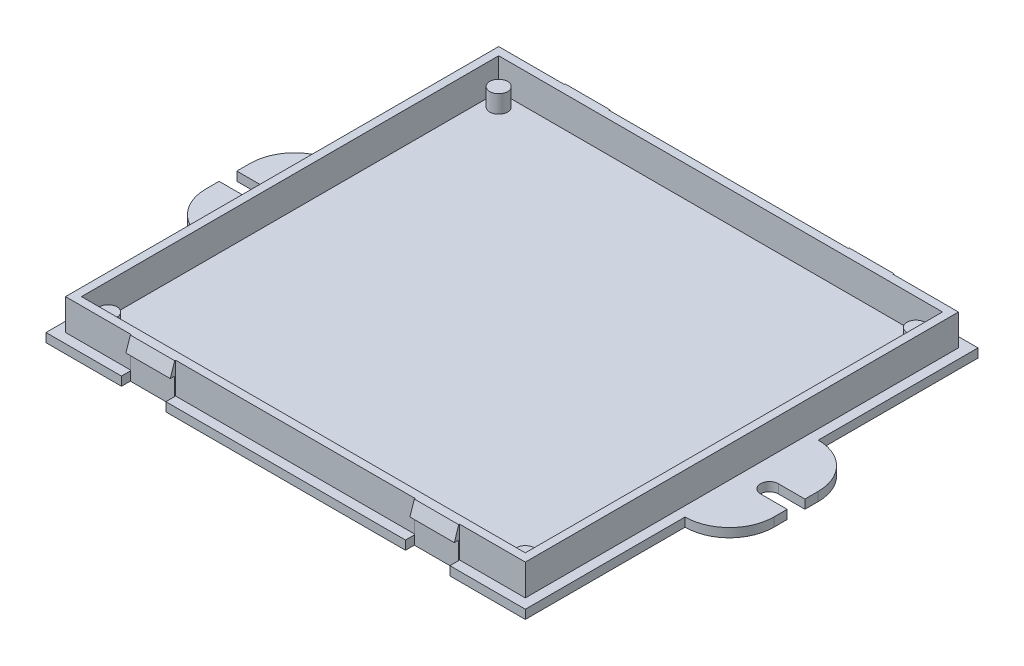
from build123d import *

# Parameters (mm, degrees)
SKETCH1_W            = 108
SKETCH1_H            = 102
BOSS_EXTRUDE1_DEPTH  = 2
SKETCH2_W            = 104
SKETCH2_H            = 98
BOSS_EXTRUDE2_DEPTH  = 7
SKETCH3_W            = 100
SKETCH3_H            = 94
CUT_EXTRUDE1_DEPTH   = 7
SKETCH4_W            = 10
SKETCH4_H            = 3
BOSS_EXTRUDE6_DEPTH  = 1
CUT_EXTRUDE2_DEPTH   = 10
SKETCH6_W            = 10
SKETCH6_H            = 3
BOSS_EXTRUDE7_DEPTH  = 1
CUT_EXTRUDE3_DEPTH   = 10
SKETCH9_W            = 10
SKETCH9_H            = 3
BOSS_EXTRUDE9_DEPTH  = 1
CUT_EXTRUDE4_DEPTH   = 10
SKETCH11_W           = 10
SKETCH11_H           = 3
BOSS_EXTRUDE10_DEPTH = 1
CUT_EXTRUDE5_DEPTH   = 10
SKETCH20_W           = 10
SKETCH20_H           = 2
CUT_EXTRUDE7_DEPTH   = 2
SKETCH21_W           = 10
SKETCH21_H           = 2
CUT_EXTRUDE8_DEPTH   = 2
SKETCH22_W           = 10
SKETCH22_H           = 2
CUT_EXTRUDE9_DEPTH   = 2
SKETCH23_W           = 10
SKETCH23_H           = 2
CUT_EXTRUDE11_DEPTH  = 2
SKETCH24_R           = 2
BOSS_EXTRUDE11_DEPTH = 4
BOSS_EXTRUDE12_DEPTH = 4
BOSS_EXTRUDE13_DEPTH = 4
BOSS_EXTRUDE14_DEPTH = 4
SKETCH28_W           = 30
SKETCH28_H           = 2
BOSS_EXTRUDE15_DEPTH = 10
SKETCH29_R           = 2
SKETCH29_W           = 6
SKETCH29_H           = 4
CUT_EXTRUDE12_DEPTH  = 2
FILLET1_R            = 10
SKETCH30_W           = 30
SKETCH30_H           = 1
BOSS_EXTRUDE16_DEPTH = 10
CUT_EXTRUDE13_DEPTH  = 2
FILLET2_R            = 10
SKETCH33_W           = 0.2
SKETCH33_H           = 98
CUT_EXTRUDE14_DEPTH  = 7
SKETCH34_W           = 14.8
SKETCH34_H           = 0.2
CUT_EXTRUDE15_DEPTH  = 7
SKETCH35_W           = 54
SKETCH35_H           = 0.2
CUT_EXTRUDE16_DEPTH  = 7
SKETCH36_W           = 15
SKETCH36_H           = 0.2
CUT_EXTRUDE17_DEPTH  = 7
SKETCH37_W           = 0.2
SKETCH37_H           = 97.8
CUT_EXTRUDE18_DEPTH  = 7
SKETCH39_W           = 14.8
SKETCH39_H           = 0.2
CUT_EXTRUDE19_DEPTH  = 7
SKETCH41_W           = 53.996290736
SKETCH41_H           = 0.2
CUT_EXTRUDE20_DEPTH  = 7
SKETCH42_W           = 14.8
SKETCH42_H           = 0.2
CUT_EXTRUDE21_DEPTH  = 7


with BuildPart() as part:
    # Sketch1 → Boss-Extrude1 (new body)
    with BuildSketch(Plane(origin=(0, 0, 0), x_dir=(1, 0, 0), z_dir=(0, 1, 0))):
        Rectangle(SKETCH1_W, SKETCH1_H)
    extrude(amount=BOSS_EXTRUDE1_DEPTH)

    # Sketch2 → Boss-Extrude2 (add)
    with BuildSketch(Plane(origin=(0, 2, 0), x_dir=(1, 0, 0), z_dir=(0, 1, 0))):
        Rectangle(SKETCH2_W, SKETCH2_H)
    extrude(amount=BOSS_EXTRUDE2_DEPTH)

    # Sketch3 → Cut-Extrude1 (cut)
    with BuildSketch(Plane(origin=(0, 9, 0), x_dir=(1, 0, 0), z_dir=(0, 1, 0))):
        Rectangle(SKETCH3_W, SKETCH3_H)
    extrude(amount=-CUT_EXTRUDE1_DEPTH, mode=Mode.SUBTRACT)

    # Sketch4 → Boss-Extrude6 (add)
    with BuildSketch(Plane.XY.offset(49)):
        with Locations((-32, 7.5)):
            Rectangle(SKETCH4_W, SKETCH4_H)
    extrude(amount=BOSS_EXTRUDE6_DEPTH)

    # Sketch5 → Cut-Extrude2 (cut)
    with BuildSketch(Plane(origin=(-27, 0, 0), x_dir=(0, 0, -1), z_dir=(1, 0, 0))):
        Polygon((-50, 6), (-49, 9), (-50, 9), align=None)
    extrude(amount=-CUT_EXTRUDE2_DEPTH, mode=Mode.SUBTRACT)

    # Sketch6 → Boss-Extrude7 (add)
    with BuildSketch(Plane.XY.offset(49)):
        with Locations((32, 7.5)):
            Rectangle(SKETCH6_W, SKETCH6_H)
    extrude(amount=BOSS_EXTRUDE7_DEPTH)

    # Sketch7 → Cut-Extrude3 (cut)
    with BuildSketch(Plane(origin=(37, 0, 0), x_dir=(0, 0, -1), z_dir=(1, 0, 0))):
        Polygon((-50, 6), (-49, 9), (-50, 9), align=None)
    extrude(amount=-CUT_EXTRUDE3_DEPTH, mode=Mode.SUBTRACT)

    # Sketch9 → Boss-Extrude9 (add)
    with BuildSketch(Plane(origin=(0, 0, -49), x_dir=(-1, 0, 0), z_dir=(0, 0, -1))):
        with Locations((-32, 7.5)):
            Rectangle(SKETCH9_W, SKETCH9_H)
    extrude(amount=BOSS_EXTRUDE9_DEPTH)

    # Sketch10 → Cut-Extrude4 (cut)
    with BuildSketch(Plane.ZY.offset(-27)):
        Polygon((-49, 9), (-50, 6), (-50, 9), align=None)
    extrude(amount=-CUT_EXTRUDE4_DEPTH, mode=Mode.SUBTRACT)

    # Sketch11 → Boss-Extrude10 (add)
    with BuildSketch(Plane(origin=(0, 0, -49), x_dir=(-1, 0, 0), z_dir=(0, 0, -1))):
        with Locations((32, 7.5)):
            Rectangle(SKETCH11_W, SKETCH11_H)
    extrude(amount=BOSS_EXTRUDE10_DEPTH)

    # Sketch12 → Cut-Extrude5 (cut)
    with BuildSketch(Plane.ZY.offset(37)):
        Polygon((-49, 9), (-50, 6), (-50, 9), align=None)
    extrude(amount=-CUT_EXTRUDE5_DEPTH, mode=Mode.SUBTRACT)

    # Sketch20 → Cut-Extrude7 (cut)
    with BuildSketch(Plane.XY.offset(51)):
        with Locations((32, 1)):
            Rectangle(SKETCH20_W, SKETCH20_H)
    extrude(amount=-CUT_EXTRUDE7_DEPTH, mode=Mode.SUBTRACT)

    # Sketch21 → Cut-Extrude8 (cut)
    with BuildSketch(Plane(origin=(0, 2, 0), x_dir=(1, 0, 0), z_dir=(0, 1, 0))):
        with Locations((-32, -50)):
            Rectangle(SKETCH21_W, SKETCH21_H)
    extrude(amount=-CUT_EXTRUDE8_DEPTH, mode=Mode.SUBTRACT)

    # Sketch22 → Cut-Extrude9 (cut)
    with BuildSketch(Plane(origin=(0, 2, 0), x_dir=(1, 0, 0), z_dir=(0, 1, 0))):
        with Locations((32, 50)):
            Rectangle(SKETCH22_W, SKETCH22_H)
    extrude(amount=-CUT_EXTRUDE9_DEPTH, mode=Mode.SUBTRACT)

    # Sketch23 → Cut-Extrude11 (cut)
    with BuildSketch(Plane(origin=(0, 2, 0), x_dir=(1, 0, 0), z_dir=(0, 1, 0))):
        with Locations((-32, 50)):
            Rectangle(SKETCH23_W, SKETCH23_H)
    extrude(amount=-CUT_EXTRUDE11_DEPTH, mode=Mode.SUBTRACT)

    # Sketch24 → Boss-Extrude11 (add)
    with BuildSketch(Plane(origin=(0, 2, 0), x_dir=(1, 0, 0), z_dir=(0, 1, 0))):
        with Locations(Location((47, 44, 0), (0, 0, 270))):
            Circle(SKETCH24_R)
    extrude(amount=BOSS_EXTRUDE11_DEPTH)

    # Sketch25 → Boss-Extrude12 (add)
    with BuildSketch(Plane(origin=(0, 2, 0), x_dir=(1, 0, 0), z_dir=(0, 1, 0))):
        with BuildLine():
            ThreePointArc((-45, 44), (-45.585786438, 45.414213562), (-47, 46))
            Line((-47, 46), (-47, 44))
            Line((-47, 44), (-49, 44))
            ThreePointArc((-49, 44), (-47, 42), (-45, 44))
        make_face()
        with BuildLine():
            Line((-47, 44), (-47, 46))
            ThreePointArc((-47, 46), (-48.414213562, 45.414213562), (-49, 44))
            Line((-49, 44), (-47, 44))
        make_face()
    extrude(amount=BOSS_EXTRUDE12_DEPTH)

    # Sketch26 → Boss-Extrude13 (add)
    with BuildSketch(Plane(origin=(0, 2, 0), x_dir=(1, 0, 0), z_dir=(0, 1, 0))):
        with BuildLine():
            ThreePointArc((-49, -44), (-48.414213562, -45.414213562), (-47, -46))
            Line((-47, -46), (-47, -44))
            Line((-47, -44), (-49, -44))
        make_face()
        with BuildLine():
            Line((-47, -44), (-47, -46))
            ThreePointArc((-47, -46), (-45.585786438, -45.414213562), (-45, -44))
            ThreePointArc((-45, -44), (-47, -42), (-49, -44))
            Line((-49, -44), (-47, -44))
        make_face()
    extrude(amount=BOSS_EXTRUDE13_DEPTH)

    # Sketch27 → Boss-Extrude14 (add)
    with BuildSketch(Plane(origin=(0, 2, 0), x_dir=(1, 0, 0), z_dir=(0, 1, 0))):
        with BuildLine():
            ThreePointArc((49, -44), (45.585786438, -42.585786438), (47, -46))
            Line((47, -46), (47, -44))
            Line((47, -44), (49, -44))
        make_face()
        with BuildLine():
            Line((47, -44), (47, -46))
            ThreePointArc((47, -46), (48.414213562, -45.414213562), (49, -44))
            Line((49, -44), (47, -44))
        make_face()
    extrude(amount=BOSS_EXTRUDE14_DEPTH)

    # Sketch28 → Boss-Extrude15 (add)
    with BuildSketch(Plane.ZY.offset(54)):
        with Locations((0, 1)):
            Rectangle(SKETCH28_W, SKETCH28_H)
    extrude(amount=BOSS_EXTRUDE15_DEPTH)

    # Sketch29 → Cut-Extrude12 (cut)
    with BuildSketch(Plane(origin=(0, 2, 0), x_dir=(1, 0, 0), z_dir=(0, 1, 0))):
        with Locations((-58, 0)):
            Circle(SKETCH29_R)
        with Locations((-61, 0)):
            Rectangle(SKETCH29_W, SKETCH29_H)
    extrude(amount=-CUT_EXTRUDE12_DEPTH, mode=Mode.SUBTRACT)

    # Fillet1
    fillet1_edges = [part.edges().sort_by_distance(p)[0] for p in [
        (-64, 1, 15),
        (-64, 1, -15),
    ]]
    fillet(fillet1_edges, radius=FILLET1_R - 0.0001)  # a hair under: the kernel refuses the full size

    # Sketch30 → Boss-Extrude16 (add)
    with BuildSketch(Plane(origin=(54, 0, 0), x_dir=(0, 0, -1), z_dir=(1, 0, 0))):
        with Locations((0, 1.5)):
            Rectangle(SKETCH30_W, SKETCH30_H)
        with Locations((0, 0.5)):
            Rectangle(SKETCH30_W, SKETCH30_H)
    extrude(amount=BOSS_EXTRUDE16_DEPTH)

    # Sketch32 → Cut-Extrude13 (cut)
    with BuildSketch(Plane(origin=(0, 2, 0), x_dir=(1, 0, 0), z_dir=(0, 1, 0))):
        with BuildLine():
            Line((58, -2), (64, -2))
            Line((64, -2), (64, 2))
            Line((64, 2), (58, 2))
            ThreePointArc((58, 2), (59.414213562, 1.414213562), (60, 0))
            ThreePointArc((60, 0), (59.414213562, -1.414213562), (58, -2))
        make_face()
        with BuildLine():
            ThreePointArc((58, 2), (56, 0), (58, -2))
            Line((58, -2), (58, 2))
        make_face()
        with BuildLine():
            Line((58, 2), (58, -2))
            ThreePointArc((58, -2), (59.414213562, -1.414213562), (60, 0))
            ThreePointArc((60, 0), (59.414213562, 1.414213562), (58, 2))
        make_face()
    extrude(amount=-CUT_EXTRUDE13_DEPTH, mode=Mode.SUBTRACT)

    # Fillet2
    fillet2_edges = [part.edges().sort_by_distance(p)[0] for p in [
        (64, 1, -15),
        (64, 1, 15),
    ]]
    fillet(fillet2_edges, radius=FILLET2_R - 0.0001)  # a hair under: the kernel refuses the full size

    # Sketch33 → Cut-Extrude14 (cut)
    with BuildSketch(Plane(origin=(0, 9, 0), x_dir=(1, 0, 0), z_dir=(0, 1, 0))):
        with Locations((51.9, 0)):
            Rectangle(SKETCH33_W, SKETCH33_H)
    extrude(amount=-CUT_EXTRUDE14_DEPTH, mode=Mode.SUBTRACT)

    # Sketch34 → Cut-Extrude15 (cut)
    with BuildSketch(Plane(origin=(0, 9, 0), x_dir=(1, 0, 0), z_dir=(0, 1, 0))):
        with Locations((44.4, 48.9)):
            Rectangle(SKETCH34_W, SKETCH34_H)
    extrude(amount=-CUT_EXTRUDE15_DEPTH, mode=Mode.SUBTRACT)

    # Sketch35 → Cut-Extrude16 (cut)
    with BuildSketch(Plane(origin=(0, 9, 0), x_dir=(1, 0, 0), z_dir=(0, 1, 0))):
        with Locations((0, 48.9)):
            Rectangle(SKETCH35_W, SKETCH35_H)
    extrude(amount=-CUT_EXTRUDE16_DEPTH, mode=Mode.SUBTRACT)

    # Sketch36 → Cut-Extrude17 (cut)
    with BuildSketch(Plane(origin=(0, 9, 0), x_dir=(1, 0, 0), z_dir=(0, 1, 0))):
        with Locations((-44.5, 48.9)):
            Rectangle(SKETCH36_W, SKETCH36_H)
    extrude(amount=-CUT_EXTRUDE17_DEPTH, mode=Mode.SUBTRACT)

    # Sketch37 → Cut-Extrude18 (cut)
    with BuildSketch(Plane(origin=(0, 9, 0), x_dir=(1, 0, 0), z_dir=(0, 1, 0))):
        with Locations((-51.9, -0.1)):
            Rectangle(SKETCH37_W, SKETCH37_H)
    extrude(amount=-CUT_EXTRUDE18_DEPTH, mode=Mode.SUBTRACT)

    # Sketch39 → Cut-Extrude19 (cut)
    with BuildSketch(Plane(origin=(0, 9, 0), x_dir=(1, 0, 0), z_dir=(0, 1, 0))):
        with Locations((-44.4, -48.9)):
            Rectangle(SKETCH39_W, SKETCH39_H)
    extrude(amount=-CUT_EXTRUDE19_DEPTH, mode=Mode.SUBTRACT)

    # Sketch41 → Cut-Extrude20 (cut)
    with BuildSketch(Plane(origin=(0, 9, 0), x_dir=(1, 0, 0), z_dir=(0, 1, 0))):
        with Locations((-0.001854632, -48.9)):
            Rectangle(SKETCH41_W, SKETCH41_H)
    extrude(amount=-CUT_EXTRUDE20_DEPTH, mode=Mode.SUBTRACT)

    # Sketch42 → Cut-Extrude21 (cut)
    with BuildSketch(Plane(origin=(0, 9, 0), x_dir=(1, 0, 0), z_dir=(0, 1, 0))):
        with Locations((44.4, -48.9)):
            Rectangle(SKETCH42_W, SKETCH42_H)
    extrude(amount=-CUT_EXTRUDE21_DEPTH, mode=Mode.SUBTRACT)


solid = part.part
